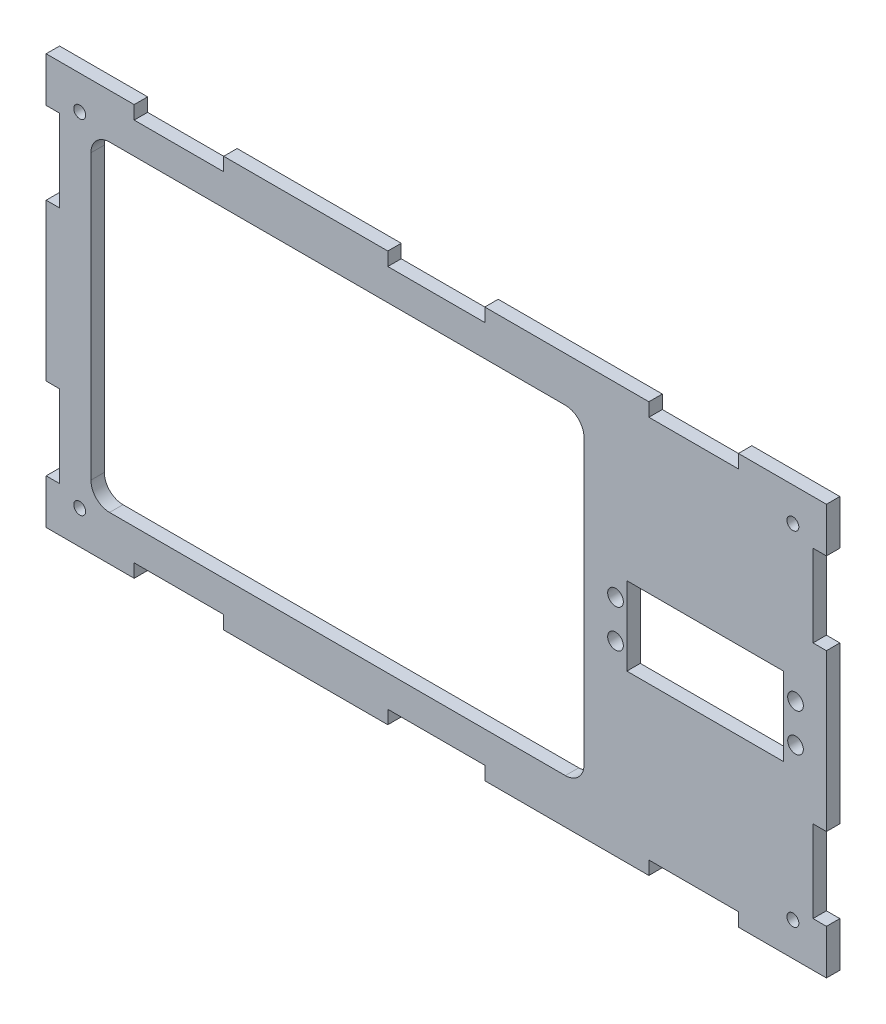
from build123d import *

# Parameters (mm, degrees)
SKETCH_1_W             = 209.2
SKETCH_1_H             = 110
SM_BASE_FLANGE_1_DEPTH = 3.6
CUT_EXTRUDE_1_REACH    = 238.384
SKETCH_6_W             = 42
SKETCH_6_H             = 21
CUT_EXTRUDE_2_REACH    = 238.384
SKETCH_7_W             = 3.6
SKETCH_7_H             = 22
SKETCH_7_W_2           = 24
SKETCH_7_H_2           = 3.6
SKETCH_7_W_3           = 26
SKETCH_8_R             = 1.6
CUT_EXTRUDE_3_DEPTH    = 10
CUT_EXTRUDE_4_REACH    = 238.384
SKETCH_9_R             = 2.1


# Sheet-metal steps are written as plain solids
with BuildPart() as part:
    # Sketch 1 → Базовая кромка1 (new body)
    with BuildSketch(Plane.XY):
        with Locations((104.6, 55)):
            Rectangle(SKETCH_1_W, SKETCH_1_H)
        with BuildLine():
            Line((17, 12), (139.2, 12))
            ThreePointArc((139.2, 12), (142.735533906, 13.464466094), (144.2, 17))
            Line((144.2, 17), (144.2, 93))
            ThreePointArc((144.2, 93), (142.735533906, 96.535533906), (139.2, 98))
            Line((139.2, 98), (17, 98))
            ThreePointArc((17, 98), (13.464466094, 96.535533906), (12, 93))
            Line((12, 93), (12, 17))
            ThreePointArc((12, 17), (13.464466094, 13.464466094), (17, 12))
        make_face(mode=Mode.SUBTRACT)
    extrude(amount=-SM_BASE_FLANGE_1_DEPTH)

    # Эскиз6 → Вырез-Вытянуть1 (cut, up to next)
    with BuildSketch(Plane.XY, mode=Mode.PRIVATE) as cut_extrude_1_sk1:
        with Locations((176.7, 55)):
            Rectangle(SKETCH_6_W, SKETCH_6_H)
    cut_extrude_1_tool1 = extrude(cut_extrude_1_sk1.sketch, amount=-CUT_EXTRUDE_1_REACH, mode=Mode.PRIVATE) & part.part
    add(cut_extrude_1_tool1.solids().sort_by_distance((176.7, 55, 0))[0], mode=Mode.SUBTRACT)

    # Эскиз7 → Вырез-Вытянуть2 (cut, up to next)
    with BuildSketch(Plane(origin=(0, 0, -3.6), x_dir=(-1, 0, 0), z_dir=(0, 0, -1)), mode=Mode.PRIVATE) as cut_extrude_2_sk1:
        with Locations((-1.8, 87)):
            Rectangle(SKETCH_7_W, SKETCH_7_H)
    cut_extrude_2_tool1 = extrude(cut_extrude_2_sk1.sketch, amount=-CUT_EXTRUDE_2_REACH, mode=Mode.PRIVATE) & part.part
    # Эскиз7 → Вырез-Вытянуть2 (cut, up to next)
    with BuildSketch(Plane(origin=(0, 0, -3.6), x_dir=(-1, 0, 0), z_dir=(0, 0, -1)), mode=Mode.PRIVATE) as cut_extrude_2_sk2:
        with Locations((-35.6, 108.2)):
            Rectangle(SKETCH_7_W_2, SKETCH_7_H_2)
    cut_extrude_2_tool2 = extrude(cut_extrude_2_sk2.sketch, amount=-CUT_EXTRUDE_2_REACH, mode=Mode.PRIVATE) & part.part
    # Эскиз7 → Вырез-Вытянуть2 (cut, up to next)
    with BuildSketch(Plane(origin=(0, 0, -3.6), x_dir=(-1, 0, 0), z_dir=(0, 0, -1)), mode=Mode.PRIVATE) as cut_extrude_2_sk3:
        with Locations((-104.6, 108.2)):
            Rectangle(SKETCH_7_W_3, SKETCH_7_H_2)
    cut_extrude_2_tool3 = extrude(cut_extrude_2_sk3.sketch, amount=-CUT_EXTRUDE_2_REACH, mode=Mode.PRIVATE) & part.part
    # Эскиз7 → Вырез-Вытянуть2 (cut, up to next)
    with BuildSketch(Plane(origin=(0, 0, -3.6), x_dir=(-1, 0, 0), z_dir=(0, 0, -1)), mode=Mode.PRIVATE) as cut_extrude_2_sk4:
        with Locations((-173.6, 108.2)):
            Rectangle(SKETCH_7_W_2, SKETCH_7_H_2)
    cut_extrude_2_tool4 = extrude(cut_extrude_2_sk4.sketch, amount=-CUT_EXTRUDE_2_REACH, mode=Mode.PRIVATE) & part.part
    # Эскиз7 → Вырез-Вытянуть2 (cut, up to next)
    with BuildSketch(Plane(origin=(0, 0, -3.6), x_dir=(-1, 0, 0), z_dir=(0, 0, -1)), mode=Mode.PRIVATE) as cut_extrude_2_sk5:
        with Locations((-207.4, 87)):
            Rectangle(SKETCH_7_W, SKETCH_7_H)
    cut_extrude_2_tool5 = extrude(cut_extrude_2_sk5.sketch, amount=-CUT_EXTRUDE_2_REACH, mode=Mode.PRIVATE) & part.part
    # Эскиз7 → Вырез-Вытянуть2 (cut, up to next)
    with BuildSketch(Plane(origin=(0, 0, -3.6), x_dir=(-1, 0, 0), z_dir=(0, 0, -1)), mode=Mode.PRIVATE) as cut_extrude_2_sk6:
        with Locations((-207.4, 23)):
            Rectangle(SKETCH_7_W, SKETCH_7_H)
    cut_extrude_2_tool6 = extrude(cut_extrude_2_sk6.sketch, amount=-CUT_EXTRUDE_2_REACH, mode=Mode.PRIVATE) & part.part
    # Эскиз7 → Вырез-Вытянуть2 (cut, up to next)
    with BuildSketch(Plane(origin=(0, 0, -3.6), x_dir=(-1, 0, 0), z_dir=(0, 0, -1)), mode=Mode.PRIVATE) as cut_extrude_2_sk7:
        with Locations((-173.6, 1.8)):
            Rectangle(SKETCH_7_W_2, SKETCH_7_H_2)
    cut_extrude_2_tool7 = extrude(cut_extrude_2_sk7.sketch, amount=-CUT_EXTRUDE_2_REACH, mode=Mode.PRIVATE) & part.part
    # Эскиз7 → Вырез-Вытянуть2 (cut, up to next)
    with BuildSketch(Plane(origin=(0, 0, -3.6), x_dir=(-1, 0, 0), z_dir=(0, 0, -1)), mode=Mode.PRIVATE) as cut_extrude_2_sk8:
        with Locations((-104.6, 1.8)):
            Rectangle(SKETCH_7_W_3, SKETCH_7_H_2)
    cut_extrude_2_tool8 = extrude(cut_extrude_2_sk8.sketch, amount=-CUT_EXTRUDE_2_REACH, mode=Mode.PRIVATE) & part.part
    # Эскиз7 → Вырез-Вытянуть2 (cut, up to next)
    with BuildSketch(Plane(origin=(0, 0, -3.6), x_dir=(-1, 0, 0), z_dir=(0, 0, -1)), mode=Mode.PRIVATE) as cut_extrude_2_sk9:
        with Locations((-35.6, 1.8)):
            Rectangle(SKETCH_7_W_2, SKETCH_7_H_2)
    cut_extrude_2_tool9 = extrude(cut_extrude_2_sk9.sketch, amount=-CUT_EXTRUDE_2_REACH, mode=Mode.PRIVATE) & part.part
    # Эскиз7 → Вырез-Вытянуть2 (cut, up to next)
    with BuildSketch(Plane(origin=(0, 0, -3.6), x_dir=(-1, 0, 0), z_dir=(0, 0, -1)), mode=Mode.PRIVATE) as cut_extrude_2_sk10:
        with Locations((-1.8, 23)):
            Rectangle(SKETCH_7_W, SKETCH_7_H)
    cut_extrude_2_tool10 = extrude(cut_extrude_2_sk10.sketch, amount=-CUT_EXTRUDE_2_REACH, mode=Mode.PRIVATE) & part.part
    add(cut_extrude_2_tool1.solids().sort_by_distance((1.8, 87, -3.6))[0], mode=Mode.SUBTRACT)
    add(cut_extrude_2_tool2.solids().sort_by_distance((35.6, 108.2, -3.6))[0], mode=Mode.SUBTRACT)
    add(cut_extrude_2_tool3.solids().sort_by_distance((104.6, 108.2, -3.6))[0], mode=Mode.SUBTRACT)
    add(cut_extrude_2_tool4.solids().sort_by_distance((173.6, 108.2, -3.6))[0], mode=Mode.SUBTRACT)
    add(cut_extrude_2_tool5.solids().sort_by_distance((207.4, 87, -3.6))[0], mode=Mode.SUBTRACT)
    add(cut_extrude_2_tool6.solids().sort_by_distance((207.4, 23, -3.6))[0], mode=Mode.SUBTRACT)
    add(cut_extrude_2_tool7.solids().sort_by_distance((173.6, 1.8, -3.6))[0], mode=Mode.SUBTRACT)
    add(cut_extrude_2_tool8.solids().sort_by_distance((104.6, 1.8, -3.6))[0], mode=Mode.SUBTRACT)
    add(cut_extrude_2_tool9.solids().sort_by_distance((35.6, 1.8, -3.6))[0], mode=Mode.SUBTRACT)
    add(cut_extrude_2_tool10.solids().sort_by_distance((1.8, 23, -3.6))[0], mode=Mode.SUBTRACT)

    # Эскиз8 → Вырез-Вытянуть3 (cut)
    with BuildSketch(Plane(origin=(0, 0, -3.6), x_dir=(-1, 0, 0), z_dir=(0, 0, -1))):
        with Locations((-200.2, 9)):
            Circle(SKETCH_8_R)
        with Locations((-9, 9)):
            Circle(SKETCH_8_R)
        with Locations((-9, 101)):
            Circle(SKETCH_8_R)
        with Locations((-200.2, 101)):
            Circle(SKETCH_8_R)
    extrude(amount=-CUT_EXTRUDE_3_DEPTH, mode=Mode.SUBTRACT)

    # Эскиз9 → Вырез-Вытянуть4 (cut, up to next)
    with BuildSketch(Plane(origin=(0, 0, -3.6), x_dir=(-1, 0, 0), z_dir=(0, 0, -1)), mode=Mode.PRIVATE) as cut_extrude_4_sk1:
        with Locations((-200.91, 60.12)):
            Circle(SKETCH_9_R)
    cut_extrude_4_tool1 = extrude(cut_extrude_4_sk1.sketch, amount=-CUT_EXTRUDE_4_REACH, mode=Mode.PRIVATE) & part.part
    # Эскиз9 → Вырез-Вытянуть4 (cut, up to next)
    with BuildSketch(Plane(origin=(0, 0, -3.6), x_dir=(-1, 0, 0), z_dir=(0, 0, -1)), mode=Mode.PRIVATE) as cut_extrude_4_sk2:
        with Locations((-200.91, 49.96)):
            Circle(SKETCH_9_R)
    cut_extrude_4_tool2 = extrude(cut_extrude_4_sk2.sketch, amount=-CUT_EXTRUDE_4_REACH, mode=Mode.PRIVATE) & part.part
    # Эскиз9 → Вырез-Вытянуть4 (cut, up to next)
    with BuildSketch(Plane(origin=(0, 0, -3.6), x_dir=(-1, 0, 0), z_dir=(0, 0, -1)), mode=Mode.PRIVATE) as cut_extrude_4_sk3:
        with Locations((-152.65, 60.12)):
            Circle(SKETCH_9_R)
    cut_extrude_4_tool3 = extrude(cut_extrude_4_sk3.sketch, amount=-CUT_EXTRUDE_4_REACH, mode=Mode.PRIVATE) & part.part
    # Эскиз9 → Вырез-Вытянуть4 (cut, up to next)
    with BuildSketch(Plane(origin=(0, 0, -3.6), x_dir=(-1, 0, 0), z_dir=(0, 0, -1)), mode=Mode.PRIVATE) as cut_extrude_4_sk4:
        with Locations((-152.65, 49.96)):
            Circle(SKETCH_9_R)
    cut_extrude_4_tool4 = extrude(cut_extrude_4_sk4.sketch, amount=-CUT_EXTRUDE_4_REACH, mode=Mode.PRIVATE) & part.part
    add(cut_extrude_4_tool1.solids().sort_by_distance((200.91, 60.12, -3.6))[0], mode=Mode.SUBTRACT)
    add(cut_extrude_4_tool2.solids().sort_by_distance((200.91, 49.96, -3.6))[0], mode=Mode.SUBTRACT)
    add(cut_extrude_4_tool3.solids().sort_by_distance((152.65, 60.12, -3.6))[0], mode=Mode.SUBTRACT)
    add(cut_extrude_4_tool4.solids().sort_by_distance((152.65, 49.96, -3.6))[0], mode=Mode.SUBTRACT)


solid = part.part
